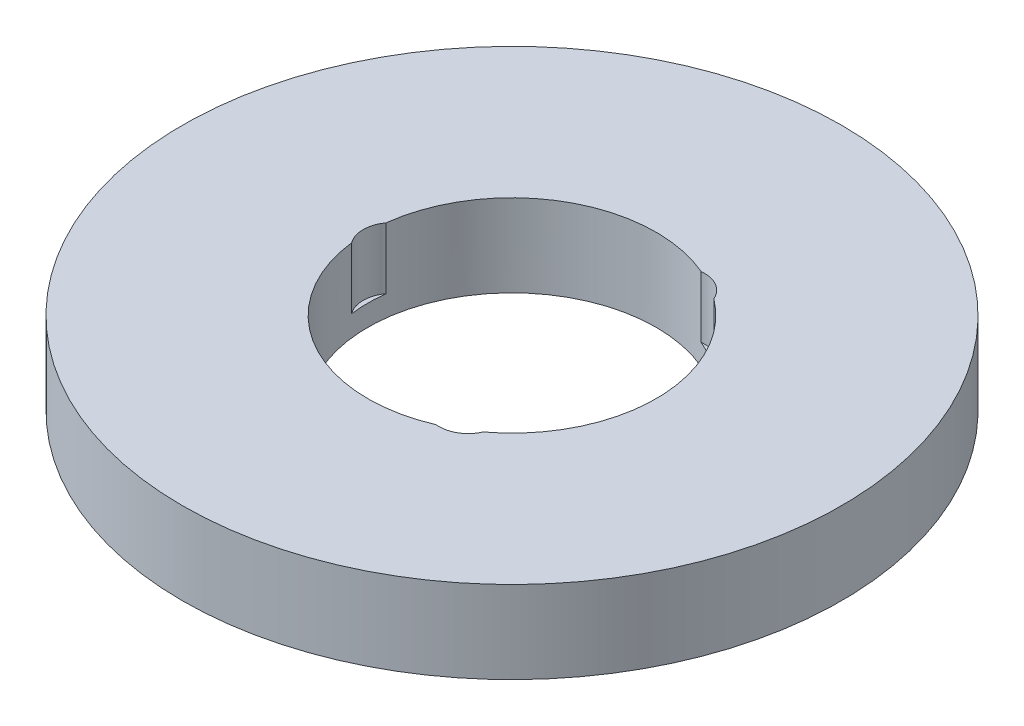
from build123d import *

# Parameters (mm, degrees)
SKETCH1_R           = 40
BOSS_EXTRUDE1_DEPTH = 10
SKETCH2_R           = 17.5
CUT_EXTRUDE1_DEPTH  = 58.445626465
SKETCH3_R           = 3.53103084
CUT_EXTRUDE2_DEPTH  = 7.445974988
CIRPATTERN1_COUNT   = 3


with BuildPart() as part:
    # Sketch1 → Boss-Extrude1 (new body)
    with BuildSketch(Plane(origin=(0, 0, 0), x_dir=(1, 0, 0), z_dir=(0, 1, 0))):
        Circle(SKETCH1_R)
    extrude(amount=BOSS_EXTRUDE1_DEPTH)

    # Sketch2 → Cut-Extrude1 (cut, through all)
    with BuildSketch(Plane(origin=(0, 0, 0), x_dir=(1, 0, 0), z_dir=(0, 1, 0))):
        Circle(SKETCH2_R)
    extrude(amount=CUT_EXTRUDE1_DEPTH, mode=Mode.SUBTRACT)

    # Sketch3 → Cut-Extrude2 (cut)
    with BuildSketch(Plane(origin=(0, 10, 0), x_dir=(1, 0, 0), z_dir=(0, 1, 0))):
        with Locations((-14.528427422, 0)):
            Circle(SKETCH3_R)
    cut_extrude2 = extrude(amount=-CUT_EXTRUDE2_DEPTH, mode=Mode.SUBTRACT)

    # CirPattern1: Cut-Extrude2 ×3 about axis
    cirpattern1_axis = Axis((0, 0, 0), (0, 1, 0))
    for i in range(1, CIRPATTERN1_COUNT):
        add(cut_extrude2.rotate(cirpattern1_axis, i * 360 / CIRPATTERN1_COUNT), mode=Mode.SUBTRACT)


solid = part.part
